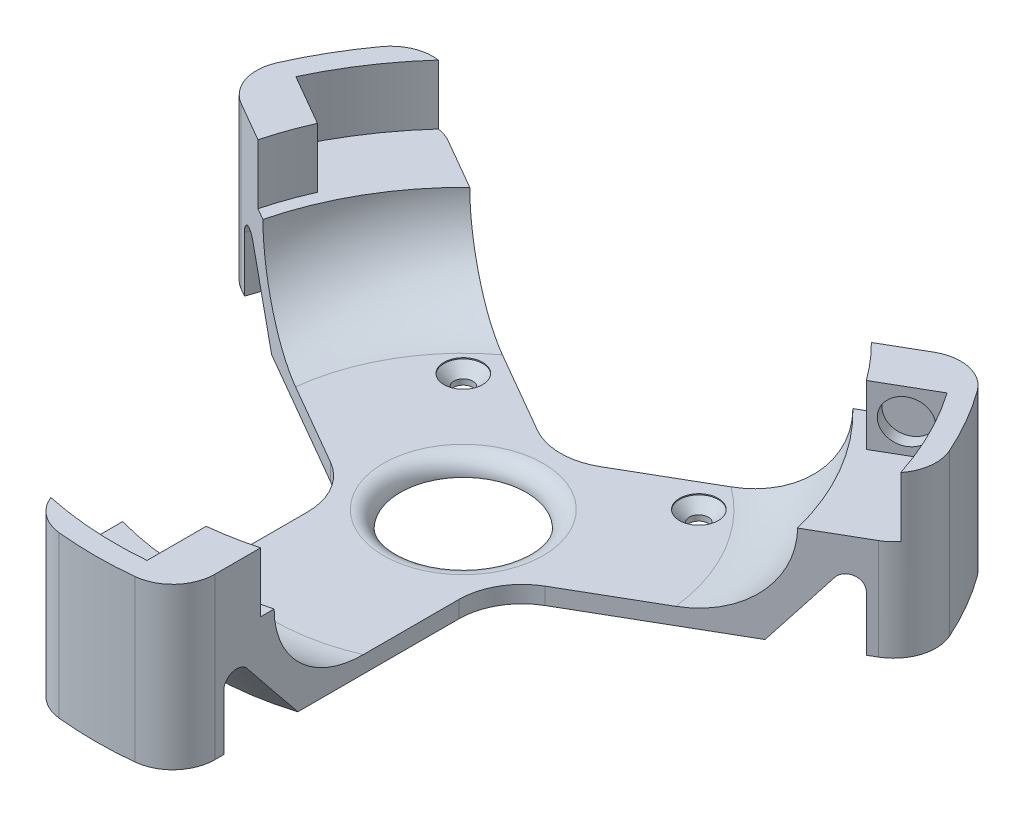
from build123d import *

# Parameters (mm, degrees)
SKETCH2_R                                      = 87.5
SKETCH2_R_2                                    = 65.5
BOSS_EXTRUDE1_DEPTH                            = 20
BOSS_EXTRUDE2_START                            = 4
SKETCH5_R                                      = 87.5
BOSS_EXTRUDE2_DEPTH                            = 4
CUT_EXTRUDE1_DEPTH                             = 127.049593434
CUT_EXTRUDE2_DEPTH                             = 20
CUT_EXTRUDE2_DEPTH_BACK                        = 0.25
SKETCH9_R                                      = 4.6
SKETCH15_R                                     = 15
CUT_EXTRUDE5_DEPTH                             = 12
FILLET1_R                                      = 15
FILLET2_R                                      = 10
FILLET4_R                                      = 4
CSK_FOR_M4_FLAT_HEAD_MACHINE_SCREW3_AT_2_COUNT = 2
CSK_FOR_M4_FLAT_HEAD_MACHINE_SCREW3_AT_2_PITCH = 88.543774485
CSK_FOR_M4_FLAT_HEAD_MACHINE_SCREW3_AT_3_COUNT = 2
CSK_FOR_M4_FLAT_HEAD_MACHINE_SCREW3_AT_3_PITCH = 88.543774485
BOSS_EXTRUDE3_DEPTH                            = 14.2
SKETCH17_R                                     = 5.1
CUT_EXTRUDE6_DEPTH                             = 3.1
CIRPATTERN1_COUNT                              = 3
FILLET5_R                                      = 3


with BuildPart() as part:
    # Sketch2 → Boss-Extrude1 (new body)
    with BuildSketch(Plane(origin=(0, 0, 0), x_dir=(1, 0, 0), z_dir=(0, 1, 0))):
        with Locations(Location((0, 0, 0), (0, 0, 270))):
            Circle(SKETCH2_R)
        with Locations(Location((0, 0, 0), (0, 0, 270))):
            Circle(SKETCH2_R_2, mode=Mode.SUBTRACT)
    extrude(amount=BOSS_EXTRUDE1_DEPTH)

    # Sketch4 → Revolve5 (revolve)
    with BuildSketch(Plane.XY):
        with BuildLine():
            Line((65.5, 20), (65.5, 0))
            Line((65.5, 0), (45.5, 0))
            add(Edge.make_bspline(
                [(45.5, 0), (65.5, 0), (65.5, 20)],
                knots=[4.71238898, 4.71238898, 4.71238898, 6.283185307, 6.283185307, 6.283185307], degree=2, weights=[1, 0.707106781, 1]))
        make_face()
    revolve(axis=Axis((0, 20, 0), (0, -1, 0)))

    # Sketch5 → Boss-Extrude2 (add)
    with BuildSketch(Plane.XZ.offset(BOSS_EXTRUDE2_START)):
        with Locations(Location((0, 0, 0), (0, 0, 270))):
            Circle(SKETCH5_R)
    extrude(amount=-BOSS_EXTRUDE2_DEPTH)

    # Sketch6 → Cut-Extrude1 (cut, through all)
    with BuildSketch(Plane.XZ.offset(4)):
        with BuildLine():
            Line((18, 10.392304845), (18, 58.283788484))
            Line((18, 58.283788484), (18, 148.916083752))
            ThreePointArc((18, 148.916083752), (129.903810568, 75), (137.965111561, -58.869584608))
            Line((137.965111561, -58.869584608), (59.475241456, -13.553436974))
            Line((59.475241456, -13.553436974), (18, 10.392304845))
        make_face()
        with BuildLine():
            Line((-18, 10.392304845), (-18, 58.283788484))
            Line((-18, 58.283788484), (-18, 148.916083752))
            ThreePointArc((-18, 148.916083752), (-129.903810568, 75), (-137.965111561, -58.869584608))
            Line((-137.965111561, -58.869584608), (-59.475241456, -13.553436974))
            Line((-59.475241456, -13.553436974), (-18, 10.392304845))
        make_face()
        with BuildLine():
            Line((0, -20.784609691), (41.475241456, -44.73035151))
            Line((41.475241456, -44.73035151), (119.965111561, -90.046499144))
            ThreePointArc((119.965111561, -90.046499144), (0, -150), (-119.965111561, -90.046499144))
            Line((-119.965111561, -90.046499144), (-41.475241456, -44.73035151))
            Line((-41.475241456, -44.73035151), (0, -20.784609691))
        make_face()
    extrude(amount=-CUT_EXTRUDE1_DEPTH, mode=Mode.SUBTRACT)

    # Sketch9 → Cut-Extrude2 (cut, two sides: drawn at the far end of the back side and taken through both)
    with BuildSketch(Plane(origin=(0, 0, 0), x_dir=(1, 0, 0), z_dir=(0, 1, 0)).offset(-CUT_EXTRUDE2_DEPTH_BACK)):
        with Locations(Location((0, -56, 0), (0, 0, 270))):
            Circle(SKETCH9_R)
        with Locations(Location((-28, 28, 0), (0, 0, 270))):
            Circle(SKETCH9_R)
        with Locations(Location((28, 28, 0), (0, 0, 270))):
            Circle(SKETCH9_R)
    extrude(amount=CUT_EXTRUDE2_DEPTH + CUT_EXTRUDE2_DEPTH_BACK, mode=Mode.SUBTRACT)

    # Sketch15 → Cut-Extrude5 (cut)
    with BuildSketch(Plane(origin=(0, 0, 0), x_dir=(1, 0, 0), z_dir=(0, 1, 0))):
        with Locations(Location((0, 0, 0), (0, 0, 270))):
            Circle(SKETCH15_R)
    extrude(amount=-CUT_EXTRUDE5_DEPTH, mode=Mode.SUBTRACT)

    # Fillet1
    fillet1_edges = [part.edges().sort_by_distance(p)[0] for p in [
        (-18, -2, 10.392304845),
        (18, -2, 10.392304845),
        (0, -2, -20.784609691),
    ]]
    fillet(fillet1_edges, radius=FILLET1_R)

    # Fillet2
    fillet2_edges = [part.edges().sort_by_distance(p)[0] for p in [
        (-18, 8, 85.62855832),
        (-83.156506795, 8, -27.225821892),
        (83.156506795, 8, -27.225821892),
        (18, 8, 85.62855832),
        (-65.156506795, 8, -58.402736428),
        (65.156506795, 8, -58.402736428),
    ]]
    fillet(fillet2_edges, radius=FILLET2_R)

    # Fillet4
    fillet4_edges = [part.edges().sort_by_distance(p)[0] for p in [
        (0, 0, -15),
    ]]
    fillet(fillet4_edges, radius=FILLET4_R - 0.0001)  # a hair under: the kernel refuses the full size

    # Sketch14 → CSK for M4 Flat Head Machine Screw3 (revolve, cut)
    with BuildSketch(Plane(origin=(0, -0.25, 56), x_dir=(0, 0, 1), z_dir=(1, 0, 0))):
        Polygon((0, 0), (0, 3.75), (2.25, 3.75), (2.25, 2.45), (4.7, 0), align=None)
    csk_for_m4_flat_head_machine_screw3 = revolve(axis=Axis((0, 6.1, 56), (0, -1, 0)), mode=Mode.SUBTRACT)

    # CSK for M4 Flat Head Machine Screw3 at 2: CSK for M4 Flat Head Machine Screw3 ×2
    with Locations(*[Vector(-0.31622776601684527, 0, -0.9486832980505113) * (i * CSK_FOR_M4_FLAT_HEAD_MACHINE_SCREW3_AT_2_PITCH) for i in range(1, CSK_FOR_M4_FLAT_HEAD_MACHINE_SCREW3_AT_2_COUNT)]):
        add(csk_for_m4_flat_head_machine_screw3, mode=Mode.SUBTRACT)

    # CSK for M4 Flat Head Machine Screw3 at 3: CSK for M4 Flat Head Machine Screw3 ×2
    with Locations(*[Vector(0.316227766016832, 0, -0.9486832980505159) * (i * CSK_FOR_M4_FLAT_HEAD_MACHINE_SCREW3_AT_3_PITCH) for i in range(1, CSK_FOR_M4_FLAT_HEAD_MACHINE_SCREW3_AT_3_COUNT)]):
        add(csk_for_m4_flat_head_machine_screw3, mode=Mode.SUBTRACT)

    # Sketch16 → Boss-Extrude3 (add)
    with BuildSketch(Plane(origin=(0, 20, 0), x_dir=(1, 0, 0), z_dir=(0, 1, 0))):
        with BuildLine():
            Line((-74.81894485, 34.998364127), (-62.640291081, 27.967015095))
            ThreePointArc((-62.640291081, 27.967015095), (-64.695649703, 22.812998696), (-66.327741975, 17.509729993))
            Line((-66.327741975, 17.509729993), (-75.758426434, 22.954538204))
            ThreePointArc((-75.758426434, 22.954538204), (-80.271013221, 28.530851156), (-79.888545974, 35.694120274))
            ThreePointArc((-79.888545974, 35.694120274), (-75.777222831, 43.75), (-70.85628791, 51.338450148))
            ThreePointArc((-70.85628791, 51.338450148), (-66.640291806, 54.687006928), (-61.299041698, 55.364135385))
            ThreePointArc((-61.299041698, 55.364135385), (-68.816551245, 45.68415781), (-74.81894485, 34.998364127))
        make_face()
    boss_extrude3 = extrude(amount=BOSS_EXTRUDE3_DEPTH)

    # Sketch17 → Cut-Extrude6 (cut)
    with BuildSketch(Plane(origin=(-3.55, 0, 6.148780367), x_dir=(-0.866025403784435, 0, -0.5000000000000062), z_dir=(0.5000000000000062, 0, -0.866025403784435))):
        with Locations((75.231590924, 27)):
            Circle(SKETCH17_R)
    cut_extrude6 = extrude(amount=-CUT_EXTRUDE6_DEPTH, mode=Mode.SUBTRACT)

    # CirPattern1: Boss-Extrude3, Cut-Extrude6 ×3 about axis
    cirpattern1_axis = Axis((0, 0, 0), (0, 1, 0))
    add([boss_extrude3.rotate(cirpattern1_axis, i * 360 / CIRPATTERN1_COUNT) for i in range(1, CIRPATTERN1_COUNT)])
    add([cut_extrude6.rotate(cirpattern1_axis, i * 360 / CIRPATTERN1_COUNT) for i in range(1, CIRPATTERN1_COUNT)], mode=Mode.SUBTRACT)

    # Sketch18 → Cut-Revolve1 (revolve, cut)
    with BuildSketch(Plane.ZY, mode=Mode.PRIVATE) as cut_revolve1_sk:
        Polygon((77.085990945, -4), (60.085990945, -4), (77.085990945, 17.894751441), align=None)
    revolve(cut_revolve1_sk.sketch.rotate(Axis((0, 20, 0), (0, -1, 0)), 180), axis=Axis((0, 20, 0), (0, -1, 0)), mode=Mode.SUBTRACT)

    # Fillet5
    fillet5_edges = [part.edges().sort_by_distance(p)[0] for p in [
        (66.758426434, 17.894751441, -38.542995473),
        (-66.758426434, 17.894751441, -38.542995473),
        (0, 17.894751441, 77.085990945),
    ]]
    fillet(fillet5_edges, radius=FILLET5_R)


solid = part.part
